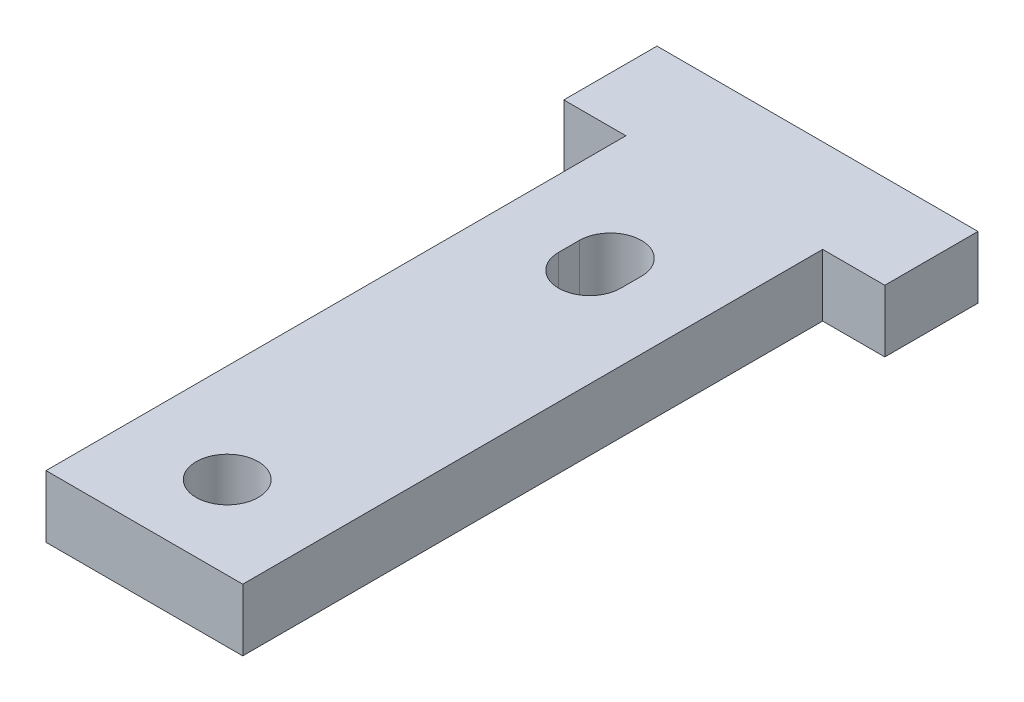
from build123d import *

# Parameters (mm, degrees)
SKETCH1_R           = 1.5
BOSS_EXTRUDE1_DEPTH = 3


with BuildPart() as part:
    # Sketch1 → Boss-Extrude1 (new body)
    with BuildSketch(Plane(origin=(0, 0, 0), x_dir=(1, 0, 0), z_dir=(0, 1, 0))):
        Polygon((-7.75, -0.706755134), (7.75, -0.706755134), (7.75, -5.206755134), (4.75, -5.206755134), (4.75, -33.206755134), (-4.75, -33.206755134), (-4.75, -5.206755134), (-7.75, -5.206755134), align=None)
        with Locations((0, -29.206755134)):
            Circle(SKETCH1_R, mode=Mode.SUBTRACT)
        with BuildLine():
            Line((1.5, -11.264845731), (1.5, -10.706755134))
            ThreePointArc((1.5, -10.706755134), (0, -9.206755134), (-1.5, -10.706755134))
            Line((-1.5, -10.706755134), (-1.5, -11.264845731))
            Line((-1.5, -11.264845731), (-1.5, -11.706755134))
            ThreePointArc((-1.5, -11.706755134), (0, -13.206755134), (1.5, -11.706755134))
            Line((1.5, -11.706755134), (1.5, -11.264845731))
        make_face(mode=Mode.SUBTRACT)
    extrude(amount=BOSS_EXTRUDE1_DEPTH)


solid = part.part
